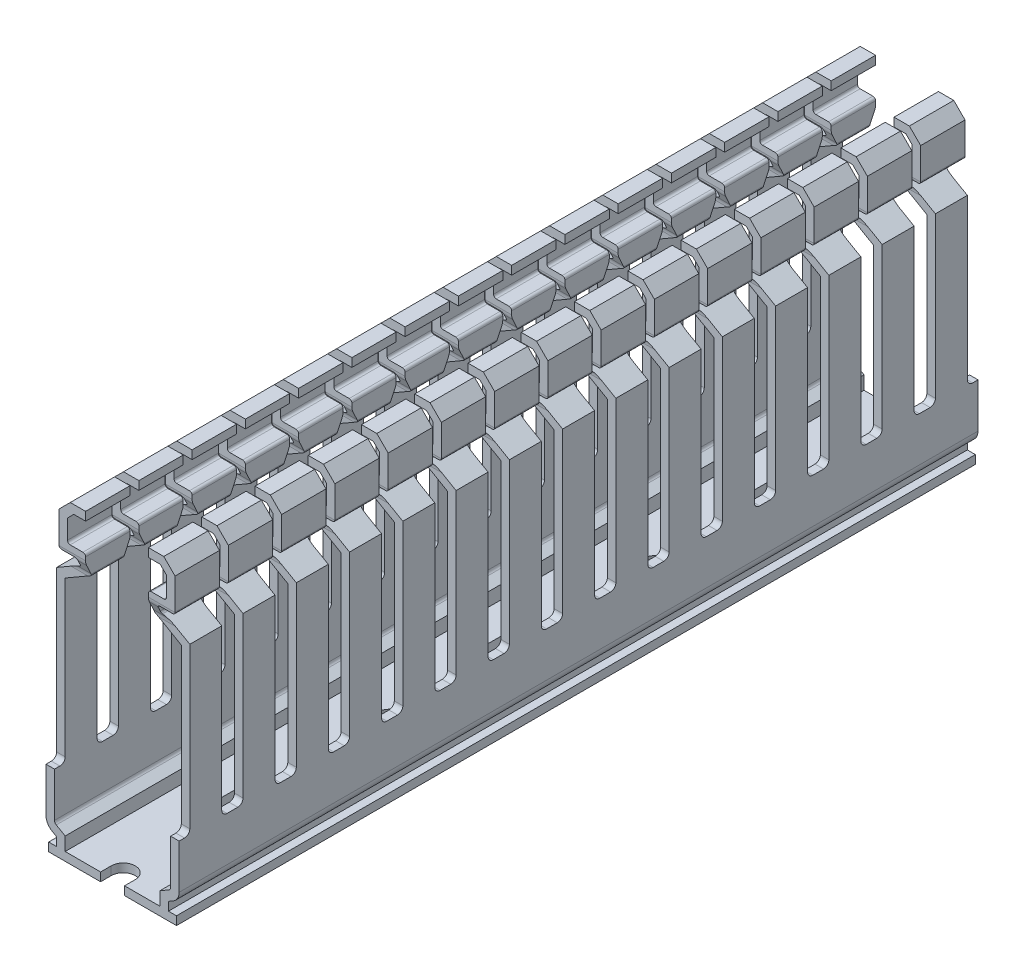
from build123d import *

# Parameters (mm, degrees)
BOSS_EXTRUDE1_DEPTH = 150
CUT_EXTRUDE1_DEPTH  = 15
LPATTERN1_COUNT     = 16
LPATTERN1_PITCH     = 10
CUT_EXTRUDE2_DEPTH  = 30
LPATTERN2_COUNT     = 4
LPATTERN2_PITCH     = 50


with BuildPart() as part:
    # Sketch1 → Boss-Extrude1 (new body)
    with BuildSketch(Plane.XY):
        with BuildLine():
            Line((-12.5, -23.335898385), (-12.5, 16))
            Line((-12.5, 16), (-7.75, 18.742413779))
            ThreePointArc((-7.75, 18.742413779), (-7.566987298, 18.925426481), (-7.5, 19.175426481))
            Line((-7.5, 19.175426481), (-7.5, 20))
            ThreePointArc((-7.5, 20), (-7.646446609, 20.353553391), (-8, 20.5))
            Line((-8, 20.5), (-10.4, 20.5))
            ThreePointArc((-10.4, 20.5), (-10.753553391, 20.646446609), (-10.9, 21))
            Line((-10.9, 21), (-10.9, 26.878679656))
            Line((-10.9, 26.878679656), (-8.778679656, 29))
            Line((-8.778679656, 29), (-5.9, 29))
            Line((-5.9, 29), (-5.9, 27.4))
            Line((-5.9, 27.4), (-8.115937957, 27.4))
            Line((-8.115937957, 27.4), (-9.3, 26.215937957))
            Line((-9.3, 26.215937957), (-9.3, 22.6))
            ThreePointArc((-9.3, 22.6), (-9.153553391, 22.246446609), (-8.8, 22.1))
            Line((-8.8, 22.1), (-6.4, 22.1))
            ThreePointArc((-6.4, 22.1), (-6.046446609, 21.953553391), (-5.9, 21.6))
            Line((-5.9, 21.6), (-5.9, 18.25166605))
            ThreePointArc((-5.9, 18.25166605), (-5.966987298, 18.00166605), (-6.15, 17.818653348))
            Line((-6.15, 17.818653348), (-10.9, 15.076239569))
            Line((-10.9, 15.076239569), (-10.9, -23.335898385))
            ThreePointArc((-10.9, -23.335898385), (-10.810511777, -23.669872981), (-10.566025404, -23.914359354))
            Line((-10.566025404, -23.914359354), (-8.9, -24.876239569))
            Line((-8.9, -24.876239569), (-8.9, -27.4))
            Line((-8.9, -27.4), (8.9, -27.4))
            Line((8.9, -27.4), (8.9, -24.876239569))
            Line((8.9, -24.876239569), (10.566025404, -23.914359354))
            ThreePointArc((10.566025404, -23.914359354), (10.810511777, -23.669872981), (10.9, -23.335898385))
            Line((10.9, -23.335898385), (10.9, 15.076239569))
            Line((10.9, 15.076239569), (6.15, 17.818653348))
            ThreePointArc((6.15, 17.818653348), (5.966987298, 18.00166605), (5.9, 18.25166605))
            Line((5.9, 18.25166605), (5.9, 21.6))
            ThreePointArc((5.9, 21.6), (6.046446609, 21.953553391), (6.4, 22.1))
            Line((6.4, 22.1), (8.8, 22.1))
            ThreePointArc((8.8, 22.1), (9.153553391, 22.246446609), (9.3, 22.6))
            Line((9.3, 22.6), (9.3, 26.215937957))
            Line((9.3, 26.215937957), (8.115937957, 27.4))
            Line((8.115937957, 27.4), (5.9, 27.4))
            Line((5.9, 27.4), (5.9, 29))
            Line((5.9, 29), (8.778679656, 29))
            Line((8.778679656, 29), (10.9, 26.878679656))
            Line((10.9, 26.878679656), (10.9, 21))
            ThreePointArc((10.9, 21), (10.753553391, 20.646446609), (10.4, 20.5))
            Line((10.4, 20.5), (8, 20.5))
            ThreePointArc((8, 20.5), (7.646446609, 20.353553391), (7.5, 20))
            Line((7.5, 20), (7.5, 19.175426481))
            ThreePointArc((7.5, 19.175426481), (7.566987298, 18.925426481), (7.75, 18.742413779))
            Line((7.75, 18.742413779), (12.5, 16))
            Line((12.5, 16), (12.5, -23.335898385))
            ThreePointArc((12.5, -23.335898385), (12.196152423, -24.469872981), (11.366025404, -25.3))
            Line((11.366025404, -25.3), (10.5, -25.8))
            Line((10.5, -25.8), (10.5, -27.4))
            Line((10.5, -27.4), (12, -27.4))
            Line((12, -27.4), (12, -29))
            Line((12, -29), (-12, -29))
            Line((-12, -29), (-12, -27.4))
            Line((-12, -27.4), (-10.5, -27.4))
            Line((-10.5, -27.4), (-10.5, -25.8))
            Line((-10.5, -25.8), (-11.366025404, -25.3))
            ThreePointArc((-11.366025404, -25.3), (-12.196152423, -24.469872981), (-12.5, -23.335898385))
        make_face()
    extrude(amount=-BOSS_EXTRUDE1_DEPTH)

    # Sketch2 → Cut-Extrude1 (cut, symmetric)
    with BuildSketch(Plane(origin=(0, 0, 0), x_dir=(0, 0, -1), z_dir=(1, 0, 0))):
        with BuildLine():
            Line((-1, -15), (1, -15))
            ThreePointArc((1, -15), (1.707106781, -14.707106781), (2, -14))
            Line((2, -14), (2, 17.556610675))
            ThreePointArc((2, 17.556610675), (1.952592014, 17.989489903), (1.812615574, 18.401847198))
            Line((1.812615574, 18.401847198), (1.021615281, 20.098152802))
            ThreePointArc((1.021615281, 20.098152802), (0.88163884, 20.510510097), (0.834230855, 20.943389325))
            Line((0.834230855, 20.943389325), (0.834230855, 30.5))
            Line((0.834230855, 30.5), (-0.834230855, 30.5))
            Line((-0.834230855, 30.5), (-0.834230855, 20.943389325))
            ThreePointArc((-0.834230855, 20.943389325), (-0.88163884, 20.510510097), (-1.021615281, 20.098152802))
            Line((-1.021615281, 20.098152802), (-1.812615574, 18.401847198))
            ThreePointArc((-1.812615574, 18.401847198), (-1.952592014, 17.989489903), (-2, 17.556610675))
            Line((-2, 17.556610675), (-2, -14))
            ThreePointArc((-2, -14), (-1.707106781, -14.707106781), (-1, -15))
        make_face()
    cut_extrude1 = extrude(amount=CUT_EXTRUDE1_DEPTH, both=True, mode=Mode.SUBTRACT)

    # LPattern1: Cut-Extrude1 ×16
    with Locations(*[(0, 0, -i * LPATTERN1_PITCH) for i in range(1, LPATTERN1_COUNT)]):
        add(cut_extrude1, mode=Mode.SUBTRACT)

    # Sketch3 → Cut-Extrude2 (cut)
    with BuildSketch(Plane.XZ.offset(29)):
        with BuildLine():
            Line((2.25, 2), (2.25, -2))
            ThreePointArc((2.25, -2), (0, -4.25), (-2.25, -2))
            Line((-2.25, -2), (-2.25, 2))
            ThreePointArc((-2.25, 2), (0, 4.25), (2.25, 2))
        make_face()
        with BuildLine():
            Line((3, -21), (3, -29))
            ThreePointArc((3, -29), (0, -32), (-3, -29))
            Line((-3, -29), (-3, -21))
            ThreePointArc((-3, -21), (0, -18), (3, -21))
        make_face()
    cut_extrude2 = extrude(amount=-CUT_EXTRUDE2_DEPTH, mode=Mode.SUBTRACT)

    # LPattern2: Cut-Extrude2 ×4
    with Locations(*[(0, 0, -i * LPATTERN2_PITCH) for i in range(1, LPATTERN2_COUNT)]):
        add(cut_extrude2, mode=Mode.SUBTRACT)


solid = part.part
